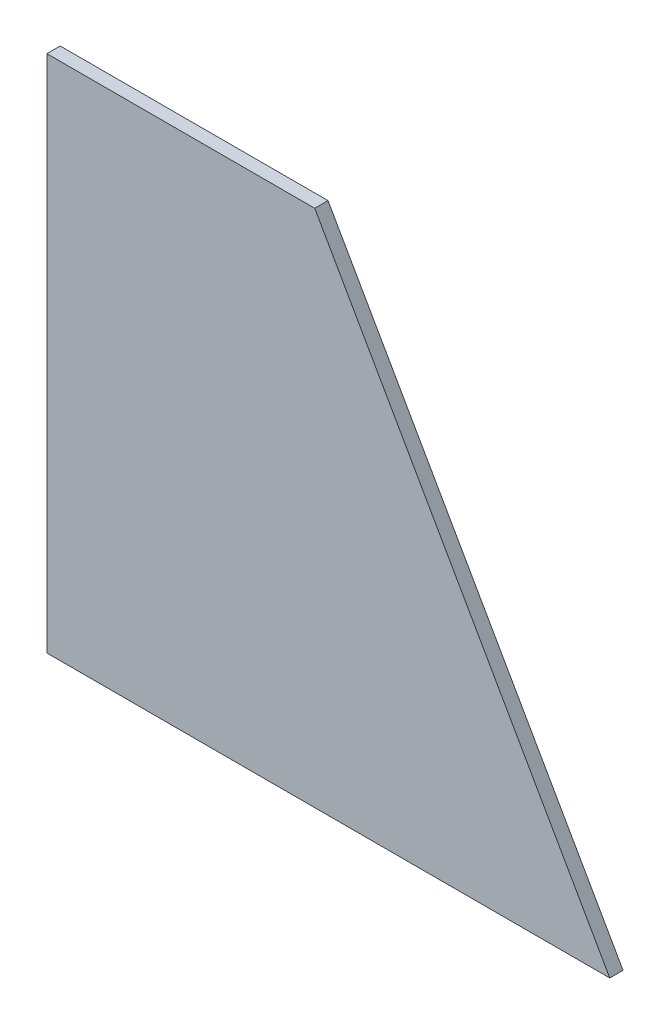
from build123d import *

# Parameters (mm, degrees)
BOSS_EXTRUDE1_DEPTH = 11.90625


with BuildPart() as part:
    # Sketch1 → Boss-Extrude1 (new body)
    with BuildSketch(Plane.XY):
        Polygon((-227.428109005, 240.559367299), (12.533782888, 240.559367299), (26.571890995, 215.857867299), (276.876049939, -224.578132701), (-227.428109005, -224.578132701), align=None)
    extrude(amount=BOSS_EXTRUDE1_DEPTH)


solid = part.part
